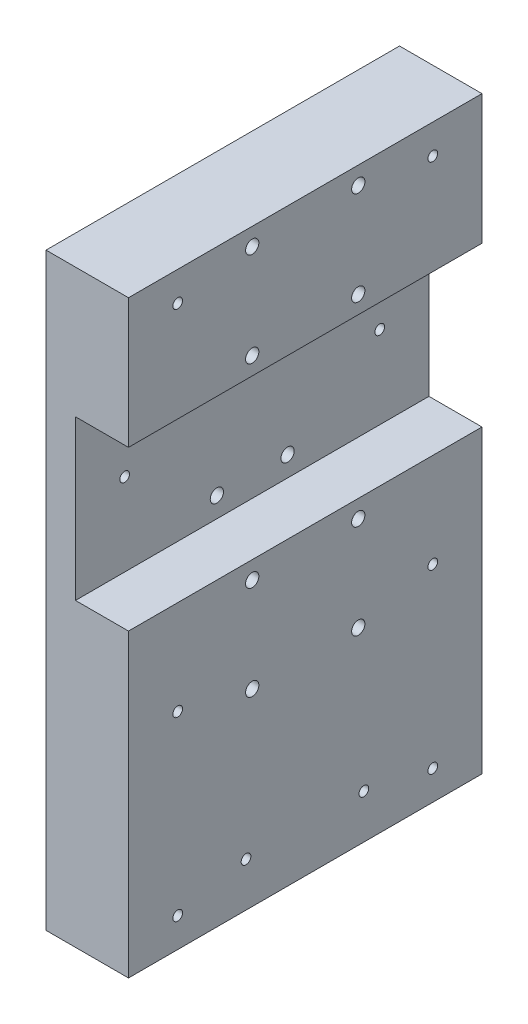
from build123d import *

# Parameters (mm, degrees)
BOSS_EXTRUDE1_DEPTH            = 120
CBORE_FOR_M4_SHCS4_D           = 4.5
CBORE_FOR_M4_SHCS4_CBORE_D     = 8
CBORE_FOR_M4_SHCS4_CBORE_DEPTH = 4
M4_TAPPED_HOLE1_D              = 3.3
M8_TAPPED_HOLE1_D              = 6.8
M8_TAPPED_HOLE1_DEPTH          = 15.75
M8_TAPPED_HOLE1_TIP            = 2.042926105
M4_TAPPED_HOLE2_D              = 3.3


with BuildPart() as part:
    # Sketch1 → Boss-Extrude1 (new body)
    with BuildSketch(Plane.XY):
        Polygon((0, 0), (0, 200), (28, 200), (28, 156), (10, 156), (10, 102), (28, 102), (28, 0), align=None)
    extrude(amount=BOSS_EXTRUDE1_DEPTH)

    # CBORE for M4 SHCS4 (through all)
    with Locations(Plane(origin=(0, 194, 78), x_dir=(0, 0, -1), z_dir=(-1, 0, 0))):
        with Locations((0, 0), (0, 32), (6, 45.14), (6, 85.14), (0, 98), (0, 130), (36, 130), (36, 98), (30, 85.14), (30, 45.14), (36, 32), (36, 0)):
            CounterBoreHole(CBORE_FOR_M4_SHCS4_D / 2, CBORE_FOR_M4_SHCS4_CBORE_D / 2, CBORE_FOR_M4_SHCS4_CBORE_DEPTH)

    # M4 Tapped Hole1 (through all)
    with Locations(Plane(origin=(0, 190, 16.7), x_dir=(0, 0, -1), z_dir=(-1, 0, 0))):
        with Locations((0, 0), (0, 60), (0, 120), (0, 180), (-86.6, 180), (-86.6, 120), (-86.6, 60), (-86.6, 0)):
            Hole(M4_TAPPED_HOLE1_D / 2)

    # M8 Tapped Hole1
    with Locations(Plane(origin=(14, 0, 95), x_dir=(-1, 0, 0), z_dir=(0, -1, 0))):
        with Locations((0, 0), (0, 35), (0, 70)):
            Hole(M8_TAPPED_HOLE1_D / 2, depth=M8_TAPPED_HOLE1_DEPTH)
            with Locations((0, 0, -(M8_TAPPED_HOLE1_DEPTH + M8_TAPPED_HOLE1_TIP / 2))):  # 118° drill point
                Cone(0, M8_TAPPED_HOLE1_D / 2, M8_TAPPED_HOLE1_TIP, mode=Mode.SUBTRACT)

    # M4 Tapped Hole2 (through all)
    with Locations(Plane(origin=(28, 15, 80.1), x_dir=(0, 1, 0), z_dir=(1, 0, 0))):
        with Locations((0, 0), (0, -40)):
            Hole(M4_TAPPED_HOLE2_D / 2)


solid = part.part
